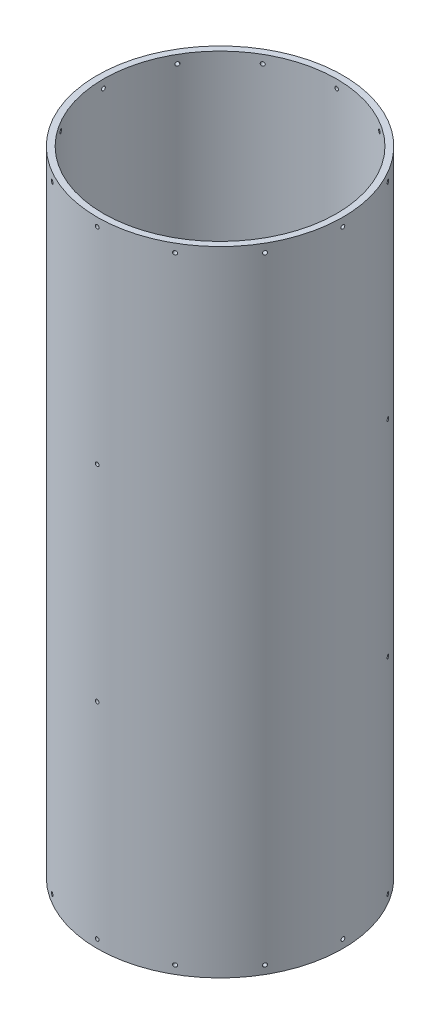
from build123d import *

# Parameters (mm, degrees)
SKETCH1_R                = 93.6625
SKETCH1_R_2              = 88.9
BOSS_EXTRUDE1_DEPTH      = 241.427
SKETCH3_R                = 1.4351
CUT_EXTRUDE1_DEPTH       = 19.304
CIRPATTERN1_COUNT        = 12
MIRROR1_COPY_1_SKETCH_R  = 1.4351
MIRROR1_COPY_1_DEPTH     = 19.304
MIRROR1_COPY_2_SKETCH_R  = 1.4351
MIRROR1_COPY_2_DEPTH     = 19.304
MIRROR1_COPY_3_SKETCH_R  = 1.4351
MIRROR1_COPY_3_DEPTH     = 19.304
MIRROR1_COPY_4_SKETCH_R  = 1.4351
MIRROR1_COPY_4_DEPTH     = 19.304
MIRROR1_COPY_5_SKETCH_R  = 1.4351
MIRROR1_COPY_5_DEPTH     = 19.304
MIRROR1_COPY_6_SKETCH_R  = 1.4351
MIRROR1_COPY_6_DEPTH     = 19.304
MIRROR1_COPY_7_SKETCH_R  = 1.4351
MIRROR1_COPY_7_DEPTH     = 19.304
MIRROR1_COPY_8_SKETCH_R  = 1.4351
MIRROR1_COPY_8_DEPTH     = 19.304
MIRROR1_COPY_9_SKETCH_R  = 1.4351
MIRROR1_COPY_9_DEPTH     = 19.304
MIRROR1_COPY_10_SKETCH_R = 1.4351
MIRROR1_COPY_10_DEPTH    = 19.304
MIRROR1_COPY_11_SKETCH_R = 1.4351
MIRROR1_COPY_11_DEPTH    = 19.304
SKETCH4_R                = 1.4351
CUT_EXTRUDE2_DEPTH       = 25.146
CIRPATTERN2_COUNT        = 3


with BuildPart() as part:
    # Sketch1 → Boss-Extrude1 (new, symmetric)
    with BuildSketch(Plane(origin=(0, 0, 0), x_dir=(1, 0, 0), z_dir=(0, 1, 0))):
        Circle(SKETCH1_R)
        Circle(SKETCH1_R_2, mode=Mode.SUBTRACT)
    extrude(amount=BOSS_EXTRUDE1_DEPTH, both=True)

    # Sketch3 → Cut-Extrude1 (cut)
    with BuildSketch(Plane.XY.offset(93.6625)):
        with Locations((0, -235.077)):
            Circle(SKETCH3_R)
    cut_extrude1 = extrude(amount=-CUT_EXTRUDE1_DEPTH, mode=Mode.SUBTRACT)

    # CirPattern1: Cut-Extrude1 ×12 about axis
    cirpattern1_axis = Axis((0, 241.427, 0), (0, -1, 0))
    for i in range(1, CIRPATTERN1_COUNT):
        add(cut_extrude1.rotate(cirpattern1_axis, i * 360 / CIRPATTERN1_COUNT), mode=Mode.SUBTRACT)

    # Mirror1: Cut-Extrude1 across plane
    add(cut_extrude1.mirror(Plane.ZX), mode=Mode.SUBTRACT)

    # Mirror1 copy 1 sketch → Mirror1 copy 1 (cut)
    with BuildSketch(Plane(origin=(-46.83125, 0, 81.114104382), x_dir=(0.8660254037844387, 0, 0.49999999999999994), z_dir=(-0.49999999999999994, 0, 0.8660254037844387))):
        with Locations((0, 235.077)):
            Circle(MIRROR1_COPY_1_SKETCH_R)
    extrude(amount=-MIRROR1_COPY_1_DEPTH, mode=Mode.SUBTRACT)

    # Mirror1 copy 2 sketch → Mirror1 copy 2 (cut)
    with BuildSketch(Plane(origin=(-81.114104382, 0, 46.83125), x_dir=(0.5000000000000001, 0, 0.8660254037844386), z_dir=(-0.8660254037844386, 0, 0.5000000000000001))):
        with Locations((0, 235.077)):
            Circle(MIRROR1_COPY_2_SKETCH_R)
    extrude(amount=-MIRROR1_COPY_2_DEPTH, mode=Mode.SUBTRACT)

    # Mirror1 copy 3 sketch → Mirror1 copy 3 (cut)
    with BuildSketch(Plane.ZY.offset(93.6625)):
        with Locations((0, 235.077)):
            Circle(MIRROR1_COPY_3_SKETCH_R)
    extrude(amount=-MIRROR1_COPY_3_DEPTH, mode=Mode.SUBTRACT)

    # Mirror1 copy 4 sketch → Mirror1 copy 4 (cut)
    with BuildSketch(Plane(origin=(-81.114104382, 0, -46.83125), x_dir=(-0.4999999999999998, 0, 0.8660254037844387), z_dir=(-0.8660254037844387, 0, -0.4999999999999998))):
        with Locations((0, 235.077)):
            Circle(MIRROR1_COPY_4_SKETCH_R)
    extrude(amount=-MIRROR1_COPY_4_DEPTH, mode=Mode.SUBTRACT)

    # Mirror1 copy 5 sketch → Mirror1 copy 5 (cut)
    with BuildSketch(Plane(origin=(-46.83125, 0, -81.114104382), x_dir=(-0.8660254037844387, 0, 0.49999999999999994), z_dir=(-0.49999999999999994, 0, -0.8660254037844387))):
        with Locations((0, 235.077)):
            Circle(MIRROR1_COPY_5_SKETCH_R)
    extrude(amount=-MIRROR1_COPY_5_DEPTH, mode=Mode.SUBTRACT)

    # Mirror1 copy 6 sketch → Mirror1 copy 6 (cut)
    with BuildSketch(Plane(origin=(0, 0, -93.6625), x_dir=(-1, 0, 0), z_dir=(0, 0, -1))):
        with Locations((0, 235.077)):
            Circle(MIRROR1_COPY_6_SKETCH_R)
    extrude(amount=-MIRROR1_COPY_6_DEPTH, mode=Mode.SUBTRACT)

    # Mirror1 copy 7 sketch → Mirror1 copy 7 (cut)
    with BuildSketch(Plane(origin=(46.83125, 0, -81.114104382), x_dir=(-0.8660254037844386, 0, -0.5000000000000001), z_dir=(0.5000000000000001, 0, -0.8660254037844386))):
        with Locations((0, 235.077)):
            Circle(MIRROR1_COPY_7_SKETCH_R)
    extrude(amount=-MIRROR1_COPY_7_DEPTH, mode=Mode.SUBTRACT)

    # Mirror1 copy 8 sketch → Mirror1 copy 8 (cut)
    with BuildSketch(Plane(origin=(81.114104382, 0, -46.83125), x_dir=(-0.5000000000000004, 0, -0.8660254037844384), z_dir=(0.8660254037844384, 0, -0.5000000000000004))):
        with Locations((0, 235.077)):
            Circle(MIRROR1_COPY_8_SKETCH_R)
    extrude(amount=-MIRROR1_COPY_8_DEPTH, mode=Mode.SUBTRACT)

    # Mirror1 copy 9 sketch → Mirror1 copy 9 (cut)
    with BuildSketch(Plane(origin=(93.6625, 0, 0), x_dir=(0, 0, -1), z_dir=(1, 0, 0))):
        with Locations((0, 235.077)):
            Circle(MIRROR1_COPY_9_SKETCH_R)
    extrude(amount=-MIRROR1_COPY_9_DEPTH, mode=Mode.SUBTRACT)

    # Mirror1 copy 10 sketch → Mirror1 copy 10 (cut)
    with BuildSketch(Plane(origin=(81.114104382, 0, 46.83125), x_dir=(0.5000000000000001, 0, -0.8660254037844386), z_dir=(0.8660254037844386, 0, 0.5000000000000001))):
        with Locations((0, 235.077)):
            Circle(MIRROR1_COPY_10_SKETCH_R)
    extrude(amount=-MIRROR1_COPY_10_DEPTH, mode=Mode.SUBTRACT)

    # Mirror1 copy 11 sketch → Mirror1 copy 11 (cut)
    with BuildSketch(Plane(origin=(46.83125, 0, 81.114104382), x_dir=(0.8660254037844384, 0, -0.5000000000000004), z_dir=(0.5000000000000004, 0, 0.8660254037844384))):
        with Locations((0, 235.077)):
            Circle(MIRROR1_COPY_11_SKETCH_R)
    extrude(amount=-MIRROR1_COPY_11_DEPTH, mode=Mode.SUBTRACT)

    # Sketch4 → Cut-Extrude2 (cut)
    with BuildSketch(Plane.XY.offset(93.6625)):
        with Locations((0, -78.359)):
            Circle(SKETCH4_R)
        with Locations((0, 78.359)):
            Circle(SKETCH4_R)
    cut_extrude2 = extrude(amount=-CUT_EXTRUDE2_DEPTH, mode=Mode.SUBTRACT)

    # CirPattern2: Cut-Extrude2 ×3 about axis
    cirpattern2_axis = Axis((0, 241.427, 0), (0, -1, 0))
    for i in range(1, CIRPATTERN2_COUNT):
        add(cut_extrude2.rotate(cirpattern2_axis, i * 360 / CIRPATTERN2_COUNT), mode=Mode.SUBTRACT)


solid = part.part
